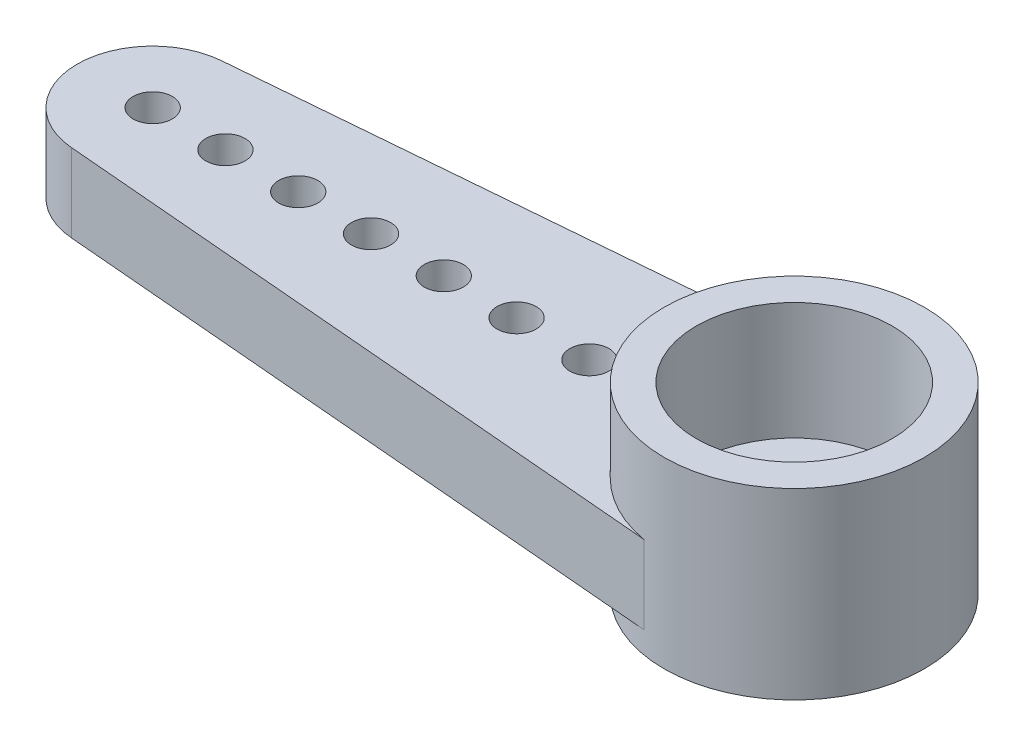
from build123d import *

# Parameters (mm, degrees)
SKETCH_1_R          = 3.325
EXTRUDE_1_DEPTH     = 2.34
SKETCH_2_R          = 2.5
CUT_EXTRUDE_1_DEPTH = 3
SKETCH_3_R          = 1
CUT_EXTRUDE_2_DEPTH = 6.577745961
EXTRUDE_2_DEPTH     = 2
SKETCH_5_R          = 0.5
CUT_EXTRUDE_3_DEPTH = 10


with BuildPart() as part:
    # 草图1 → 凸台-拉伸1 (new, symmetric)
    with BuildSketch(Plane(origin=(0, 0, 0), x_dir=(1, 0, 0), z_dir=(0, 1, 0))):
        Circle(SKETCH_1_R)
    extrude(amount=EXTRUDE_1_DEPTH, both=True)

    # 草图2 → 切除-拉伸1 (cut)
    with BuildSketch(Plane(origin=(0, 2.34, 0), x_dir=(1, 0, 0), z_dir=(0, 1, 0))):
        Circle(SKETCH_2_R)
    extrude(amount=-CUT_EXTRUDE_1_DEPTH, mode=Mode.SUBTRACT)

    # 草图3 → 切除-拉伸2 (cut, through all)
    with BuildSketch(Plane(origin=(0, -0.66, 0), x_dir=(1, 0, 0), z_dir=(0, 1, 0))):
        Circle(SKETCH_3_R)
    extrude(amount=-CUT_EXTRUDE_2_DEPTH, mode=Mode.SUBTRACT)

    # 草图4 → 凸台-拉伸2 (add)
    with BuildSketch(Plane(origin=(0, 0.22, 0), x_dir=(-1, 0, 0), z_dir=(0, -1, 0))):
        with BuildLine():
            Line((0, 3.325), (16.55, 1.92))
            ThreePointArc((16.55, 1.92), (18.325, 0), (16.55, -1.92))
            Line((16.55, -1.92), (0, -3.325))
            ThreePointArc((0, -3.325), (2.566190787, 0), (0, 3.325))
        make_face()
    extrude(amount=EXTRUDE_2_DEPTH)

    # 草图5 → 切除-拉伸3 (cut)
    with BuildSketch(Plane(origin=(0, -1.78, 0), x_dir=(-1, 0, 0), z_dir=(0, -1, 0))):
        with Locations((14.535, 0)):
            Circle(SKETCH_5_R)
        with Locations((16.395, 0)):
            Circle(SKETCH_5_R)
        with Locations((12.675, 0)):
            Circle(SKETCH_5_R)
        with Locations((10.815, 0)):
            Circle(SKETCH_5_R)
        with Locations((8.955, 0)):
            Circle(SKETCH_5_R)
        with Locations((7.095, 0)):
            Circle(SKETCH_5_R)
        with Locations((5.235, 0)):
            Circle(SKETCH_5_R)
    extrude(amount=-CUT_EXTRUDE_3_DEPTH, mode=Mode.SUBTRACT)


solid = part.part
